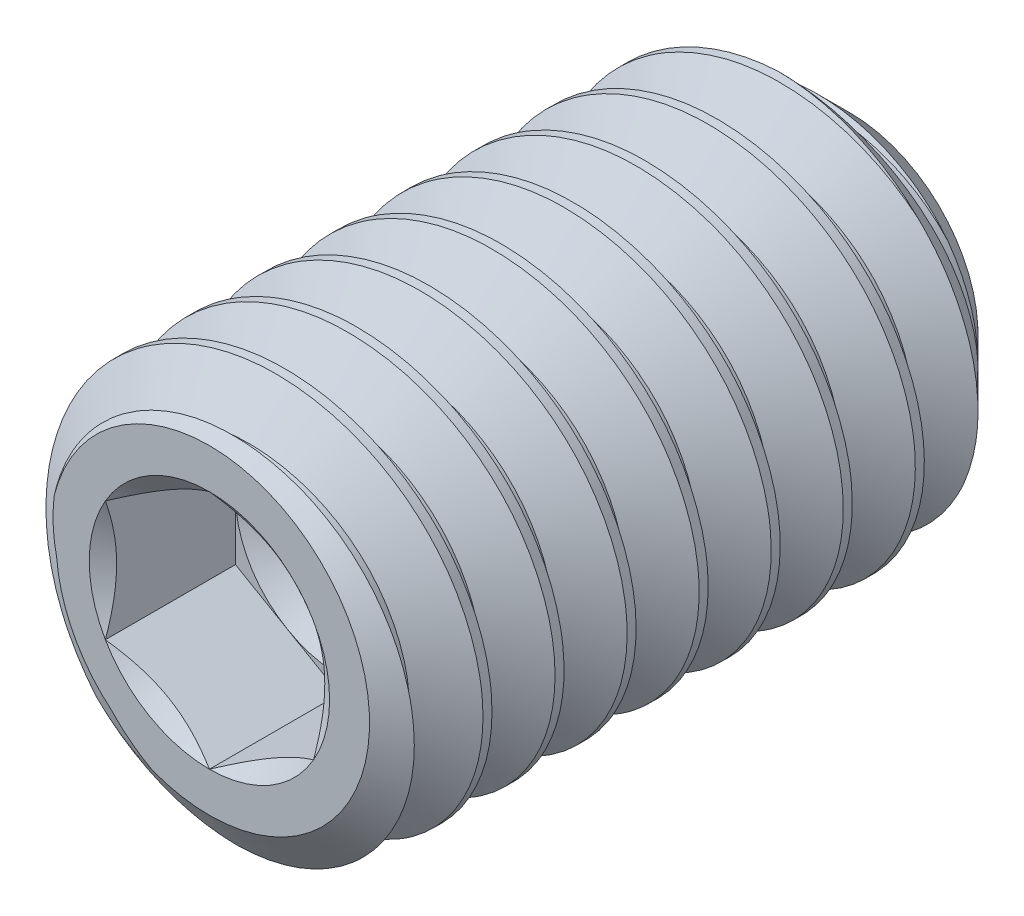
from build123d import *

# Parameters (mm, degrees)
CUT_SWEEP2_PITCH    = 0.45
CUT_EXTRUDE10_DEPTH = 0.8125


with BuildPart() as part:
    # Sketch22 → Revolve1 (revolve)
    with BuildSketch(Plane(origin=(0, 0, 0), x_dir=(0, 0, -1), z_dir=(1, 0, 0)), mode=Mode.PRIVATE) as revolve1_sk:
        Polygon((-2, 0), (-2, 1), (-1.824948115, 1.25), (1.55, 1.25), (2, 0.8), (2, 0), align=None)
    revolve(revolve1_sk.sketch.rotate(Axis((0, 0, -2), (0, 0, 1)), 90), axis=Axis((0, 0, -2), (0, 0, 1)))

    # Cut-Sweep2: the profile of Sketch28 profile screwed along a right-hand helix of 9.888889 turns, 6 arcs to a turn; built about Z, then put on its axis
    cut_sweep2_z = Axis((0, 0, 0), (0, 0, 1))
    cut_sweep2_corners = [(1.2503, 0, 0.000173205), (1.2503, 0, -0.393923205), (0.957716426, 0, -0.225), (0.957716426, 0, -0.16875)]
    with BuildLine(mode=Mode.PRIVATE) as cut_sweep2_profile:
        Line(cut_sweep2_corners[0], cut_sweep2_corners[1])
        Line(cut_sweep2_corners[1], cut_sweep2_corners[2])
        Line(cut_sweep2_corners[2], cut_sweep2_corners[3])
        Line(cut_sweep2_corners[3], cut_sweep2_corners[0])
    cut_sweep2_cap = Face(cut_sweep2_profile.wire())
    cut_sweep2_turn_angles = [0, 30, 60, 90, 120, 150, 180, 210, 240, 270, 300, 330, 360]
    cut_sweep2_turn_weights = [1, 0.8660254037844387, 1, 0.8660254037844387, 1, 0.8660254037844387, 1, 0.8660254037844387, 1, 0.8660254037844387, 1, 0.8660254037844387, 1]
    cut_sweep2_turn_rails = [Edge.make_bspline([Vector(p[0], p[1], 0).rotate(cut_sweep2_z, cut_sweep2_turn_angles[k]) / cut_sweep2_turn_weights[k] + Vector(0, 0, p[2] + CUT_SWEEP2_PITCH * cut_sweep2_turn_angles[k] / 360) for k in range(13)], [0, 0, 0, 1, 1, 2, 2, 3, 3, 4, 4, 5, 5, 6, 6, 6], 2, cut_sweep2_turn_weights) for p in cut_sweep2_corners]
    cut_sweep2_turn_sides = [Face.make_surface_from_curves(cut_sweep2_turn_rails[p[0]], cut_sweep2_turn_rails[p[1]]) for p in [(0, 1), (1, 2), (2, 3), (3, 0)]]
    cut_sweep2_last_angles = [3240, 3270, 3300, 3330, 3360, 3390, 3420, 3450, 3480, 3510, 3540, 3550, 3560]
    cut_sweep2_last_weights = [1, 0.8660254037844387, 1, 0.8660254037844387, 1, 0.8660254037844387, 1, 0.8660254037844387, 1, 0.8660254037844387, 1, 0.9848077530122039, 1]
    cut_sweep2_last_rails = [Edge.make_bspline([Vector(p[0], p[1], 0).rotate(cut_sweep2_z, cut_sweep2_last_angles[k]) / cut_sweep2_last_weights[k] + Vector(0, 0, p[2] + CUT_SWEEP2_PITCH * cut_sweep2_last_angles[k] / 360) for k in range(13)], [0, 0, 0, 1, 1, 2, 2, 3, 3, 4, 4, 5, 5, 6, 6, 6], 2, cut_sweep2_last_weights) for p in cut_sweep2_corners]
    cut_sweep2_last_sides = [Face.make_surface_from_curves(cut_sweep2_last_rails[p[0]], cut_sweep2_last_rails[p[1]]) for p in [(0, 1), (1, 2), (2, 3), (3, 0)]]
    cut_sweep2 = Plane(origin=(0, 0, -2), x_dir=(0, 1, 0), z_dir=(0, 0, 1)) * Solid(Shell([*[p.moved(Location((0, 0, CUT_SWEEP2_PITCH * i))) for i in range(9) for p in cut_sweep2_turn_sides], *cut_sweep2_last_sides, cut_sweep2_cap, cut_sweep2_cap.rotate(cut_sweep2_z, 3560).moved(Location((0, 0, CUT_SWEEP2_PITCH * 3560 / 360)))]))
    add(cut_sweep2, mode=Mode.SUBTRACT)

    # Sketch23 → Cut-Extrude10 (cut)
    with BuildSketch(Plane.XY.offset(2)):
        Polygon((0, 0.75055535), (-0.65, 0.375277675), (-0.65, -0.375277675), (0, -0.75055535), (0.65, -0.375277675), (0.65, 0.375277675), align=None)
    extrude(amount=-CUT_EXTRUDE10_DEPTH, mode=Mode.SUBTRACT)

    # Cut-Extrude11 cone 1 section (through the dimple's axis) → Cut-Extrude11 (revolve, cut)
    with BuildSketch(Plane(origin=(0, 0, 2), x_dir=(0, -1, 0), z_dir=(1, 0, 0))):
        Polygon((0, 0), (0.75055535, 0), (0, 0.525544514), align=None)
    revolve(axis=Axis((0, 0, 2), (0, 0, -1)), mode=Mode.SUBTRACT)

    # Cut-Extrude12 cone 1 section (through the dimple's axis) → Cut-Extrude12 (revolve, cut)
    with BuildSketch(Plane(origin=(0, 0, 1.1875), x_dir=(0, -1, 0), z_dir=(1, 0, 0))):
        Polygon((0, 0), (0.65, 0), (0, 0.375277675), align=None)
    revolve(axis=Axis((0, 0, 1.1875), (0, 0, -1)), mode=Mode.SUBTRACT)


solid = part.part
